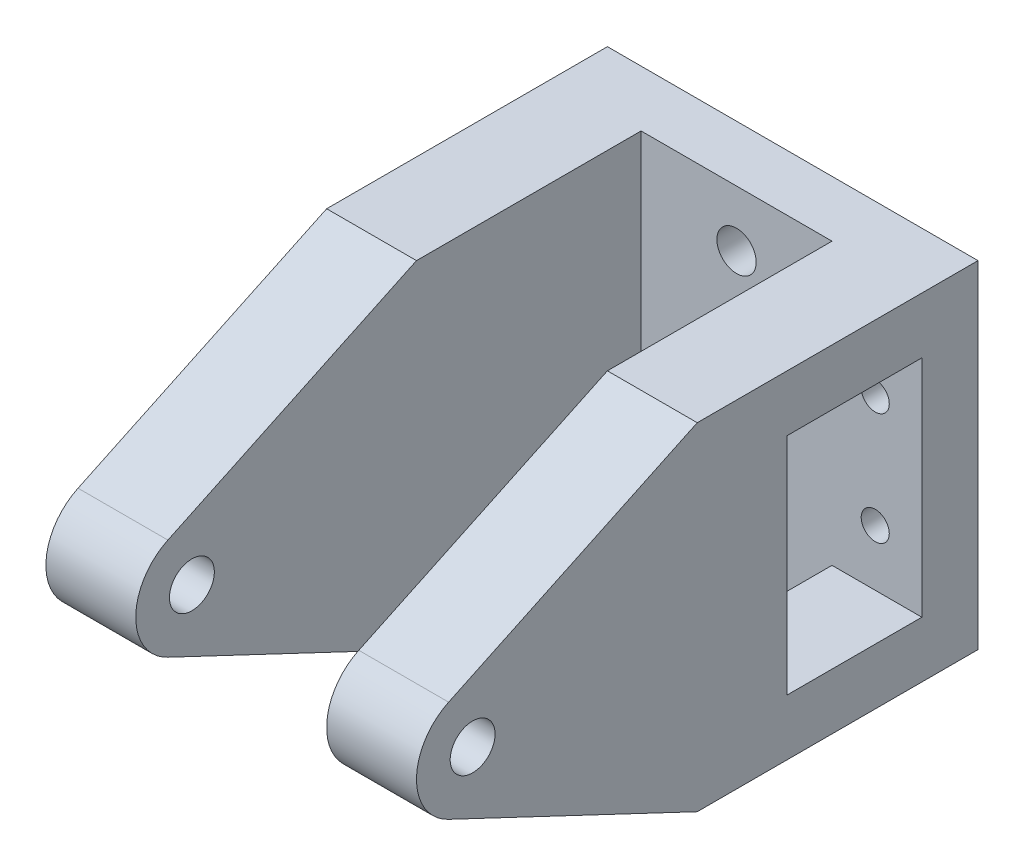
from build123d import *

# Parameters (mm, degrees)
SKETCH_1_W          = 33
SKETCH_1_H          = 30
EXTRUDE_1_DEPTH     = 5
SKETCH_3_R          = 2
EXTRUDE_2_DEPTH     = 8
SKETCH_4_R          = 1.75
CUT_EXTRUDE_1_DEPTH = 51.222007128
SKETCH_5_R          = 1.25
CUT_EXTRUDE_2_DEPTH = 5
CUT_EXTRUDE_3_REACH = 63.758
SKETCH_6_W          = 12
SKETCH_6_H          = 20


with BuildPart() as part:
    # ｽｹｯﾁ1 → ﾎﾞｽ - 押し出し1 (new body)
    with BuildSketch(Plane.XY):
        Rectangle(SKETCH_1_W, SKETCH_1_H)
    extrude(amount=EXTRUDE_1_DEPTH)

    # ｽｹｯﾁ3 → ﾎﾞｽ - 押し出し2 (add)
    with BuildSketch(Plane(origin=(16.5, 0, 0), x_dir=(0, 0, -1), z_dir=(1, 0, 0))):
        with BuildLine():
            Line((-5, 15), (-25, 15))
            Line((-25, 15), (-47.139387691, 4.519183588))
            ThreePointArc((-47.139387691, 4.519183588), (-50, 0), (-47.139387691, -4.519183588))
            Line((-47.139387691, -4.519183588), (-25, -15))
            Line((-25, -15), (-5, -15))
            Line((-5, -15), (-5, 15))
        make_face()
        with Locations((-45, 0)):
            Circle(SKETCH_3_R, mode=Mode.SUBTRACT)
    extrude_2 = extrude(amount=-EXTRUDE_2_DEPTH)

    # ﾐﾗｰ1: ﾎﾞｽ - 押し出し2 across plane
    add(extrude_2.mirror(Plane(origin=(0, 0, 0), x_dir=(0, 0, 1), z_dir=(1, 0, 0))))

    # ｽｹｯﾁ4 → ｶｯﾄ - 押し出し1 (cut, through all)
    with BuildSketch(Plane.XY.offset(5)):
        with Locations((0, 10)):
            Circle(SKETCH_4_R)
        with Locations((0, -10)):
            Circle(SKETCH_4_R)
    extrude(amount=-CUT_EXTRUDE_1_DEPTH, mode=Mode.SUBTRACT)

    # ｽｹｯﾁ5 → ｶｯﾄ - 押し出し2 (cut)
    with BuildSketch(Plane.XY):
        with Locations((12.35, -5)):
            Circle(SKETCH_5_R)
        with Locations((12.35, 5)):
            Circle(SKETCH_5_R)
    extrude(amount=CUT_EXTRUDE_2_DEPTH, mode=Mode.SUBTRACT)

    # ｽｹｯﾁ6 → ｶｯﾄ - 押し出し3 (cut, up to next)
    with BuildSketch(Plane(origin=(16.5, 0, 0), x_dir=(0, 0, -1), z_dir=(1, 0, 0)), mode=Mode.PRIVATE) as cut_extrude_3_sk1:
        with Locations((-11, 0)):
            Rectangle(SKETCH_6_W, SKETCH_6_H)
    cut_extrude_3_tool1 = extrude(cut_extrude_3_sk1.sketch, amount=-CUT_EXTRUDE_3_REACH, mode=Mode.PRIVATE) & part.part
    add(cut_extrude_3_tool1.solids().sort_by_distance((16.5, 0, 11))[0], mode=Mode.SUBTRACT)


solid = part.part
